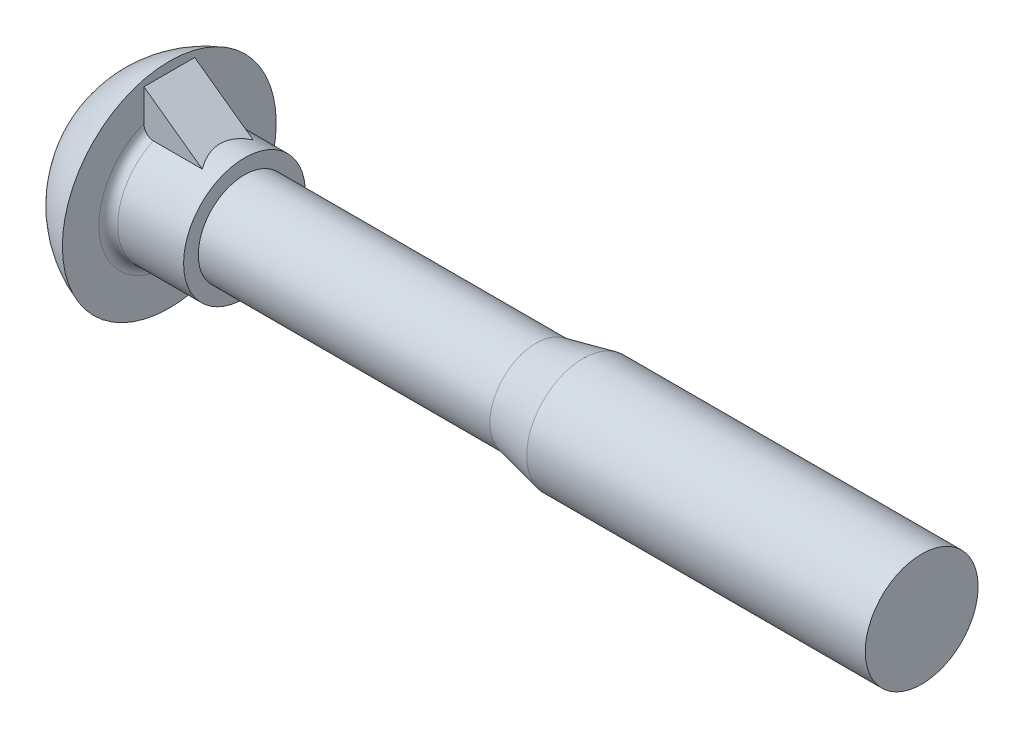
from build123d import *

# Parameters (mm, degrees)
NIB_REACH      = 46.807
SKETCH2_WALL_W = 94.941468098
SKETCH2_WALL_H = 2.7


with BuildPart() as part:
    # Sketch1 → Base (revolve)
    with BuildSketch(Plane.XY):
        with BuildLine():
            Line((44.08, 0), (44.08, 3))
            Line((44.08, 3), (8.08, 3))
            Line((8.08, 3), (8.08, 3.24))
            Line((8.08, 3.24), (4.58, 3.24))
            ThreePointArc((4.58, 3.24), (4.226446609, 3.386446609), (4.08, 3.74))
            Line((4.08, 3.74), (4.08, 5.684505256))
            ThreePointArc((4.08, 5.684505256), (1.125576957, 3.498571137), (0, 0))
            Line((0, 0), (44.08, 0))
        make_face()
    revolve(axis=Axis((-31.484345479, 0, 0), (1, 0, 0)))

    # Sketch2 wall → Nib (add, up to next)
    with BuildSketch(Plane(origin=(5.43, 4.212252628, 0), x_dir=(-0.811462330335, 0.58440472829, 0), z_dir=(-0.58440472829, -0.811462330335, 0)), mode=Mode.PRIVATE) as nib_sk1:
        Rectangle(SKETCH2_WALL_W, SKETCH2_WALL_H)
    nib_tool1 = extrude(nib_sk1.sketch, amount=NIB_REACH, mode=Mode.PRIVATE) - part.part
    add(nib_tool1.solids().sort_by_distance((5.43, 4.212252628, 0))[0])

    # Sketch3 → Cut-Revolve1 (revolve, cut)
    with BuildSketch(Plane.XY):
        Polygon((26.08, 3), (23.58, 2.4585), (8.08, 2.4585), (8.08, 3), align=None)
    revolve(axis=Axis((-29.816341648, 0, 0), (1, 0, 0)), mode=Mode.SUBTRACT)


solid = part.part
